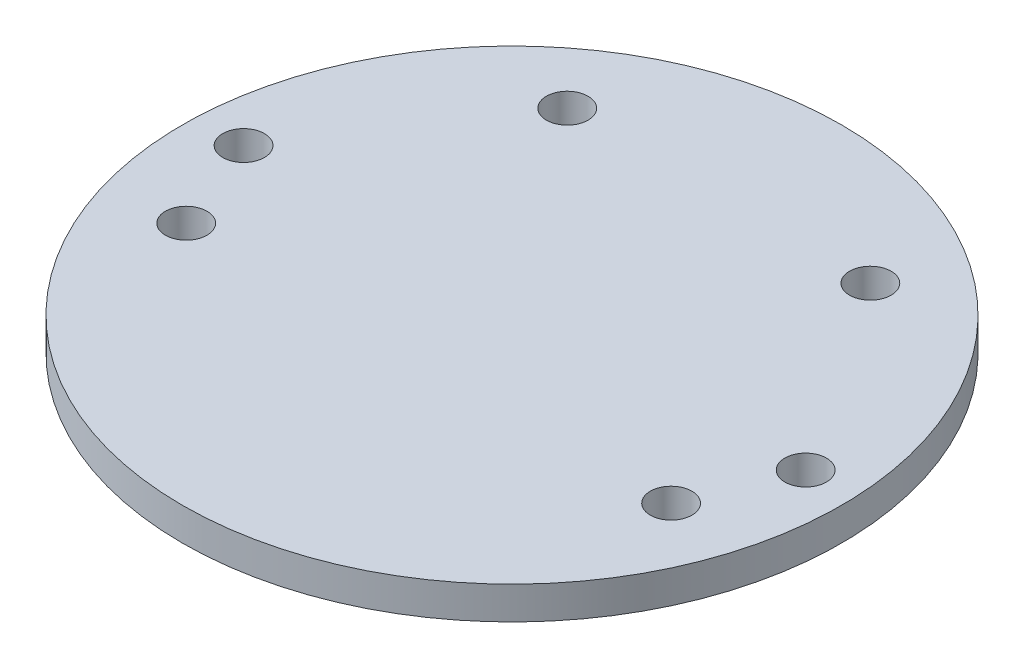
from build123d import *

# Parameters (mm, degrees)
SKETCH1_R           = 50.292
SKETCH1_R_2         = 3.175
BOSS_EXTRUDE1_DEPTH = 5


with BuildPart() as part:
    # Sketch1 → Boss-Extrude1 (new body)
    with BuildSketch(Plane(origin=(0, 0, 0), x_dir=(1, 0, 0), z_dir=(0, 1, 0))):
        Circle(SKETCH1_R)
        with Locations((-37.000474826, -12.718618748)):
            Circle(SKETCH1_R_2, mode=Mode.SUBTRACT)
        with Locations((37.000474826, -12.718618748)):
            Circle(SKETCH1_R_2, mode=Mode.SUBTRACT)
        with Locations((-42.886820356, 1.924977859)):
            Circle(SKETCH1_R_2, mode=Mode.SUBTRACT)
        with Locations((-23.129730363, 31.556520301)):
            Circle(SKETCH1_R_2, mode=Mode.SUBTRACT)
        with Locations((42.886820356, 1.924977859)):
            Circle(SKETCH1_R_2, mode=Mode.SUBTRACT)
        with Locations((23.129730363, 31.556520301)):
            Circle(SKETCH1_R_2, mode=Mode.SUBTRACT)
    extrude(amount=BOSS_EXTRUDE1_DEPTH)


solid = part.part
